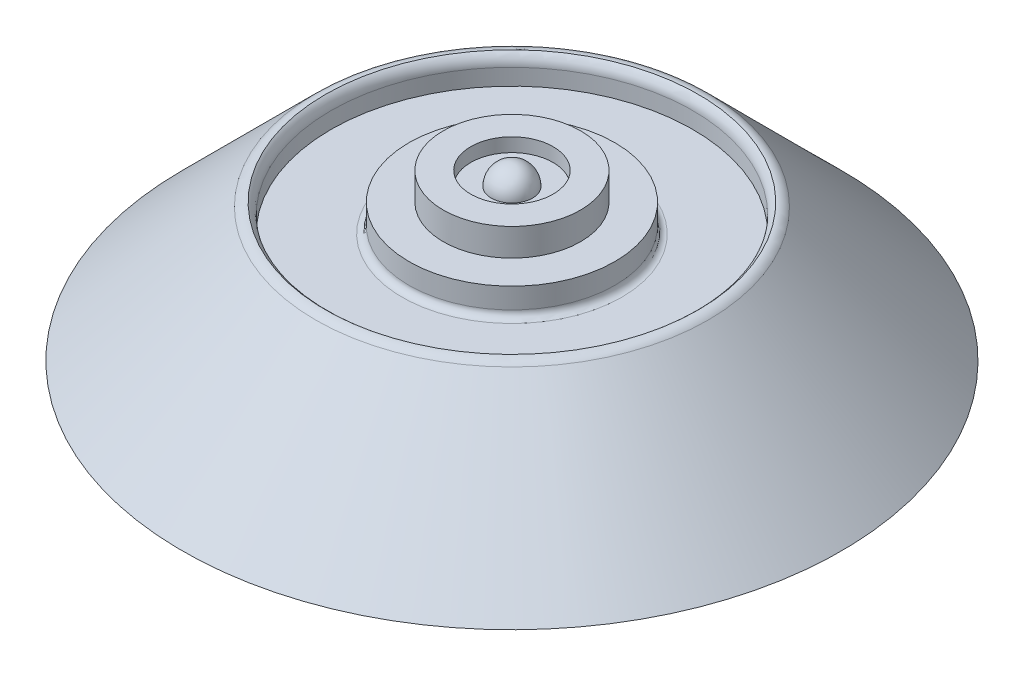
from build123d import *

# Parameters (mm, degrees)
FILLET1_R           = 2.54
SKETCH3_R           = 33.455795103
SKETCH3_R_2         = 19.05
CUT_EXTRUDE1_DEPTH  = 5.08
SKETCH4_R           = 12.7
BOSS_EXTRUDE1_DEPTH = 5.08
SKETCH5_R           = 7.62
CUT_EXTRUDE2_DEPTH  = 2.54
FILLET6_R           = 1.27
REVOLVE2_ANGLE      = 180
SCALE1_SCALE        = 0.5


with BuildPart() as part:
    # Sketch1 → Revolve1 (revolve)
    with BuildSketch(Plane.XY, mode=Mode.PRIVATE) as revolve1_sk:
        Polygon((0, 0), (0, -25.4), (60.96, -25.4), (35.56, 0), align=None)
    revolve(revolve1_sk.sketch.rotate(Axis((0, 0, 0), (0, -1, 0)), 180), axis=Axis((0, 0, 0), (0, -1, 0)))

    # Fillet1
    fillet1_edges = [part.edges().sort_by_distance(p)[0] for p in [
        (35.56, 0, 0),
    ]]
    fillet(fillet1_edges, radius=FILLET1_R)

    # Sketch3 → Cut-Extrude1 (cut)
    with BuildSketch(Plane(origin=(0, 0, 0), x_dir=(1, 0, 0), z_dir=(0, 1, 0))):
        with Locations(Location((0, 0, 0), (0, 0, 180))):
            Circle(SKETCH3_R)
        with Locations(Location((0, 0, 0), (0, 0, 180))):
            Circle(SKETCH3_R_2, mode=Mode.SUBTRACT)
    extrude(amount=-CUT_EXTRUDE1_DEPTH, mode=Mode.SUBTRACT)

    # Fillet4: read off the stored shape, not the designer's step
    # Fillet4 outline → Fillet4 (revolve, cut)
    with BuildSketch(Plane.XY):
        with BuildLine():
            ThreePointArc((33.455795103, -2.058582249), (33.73406349, -0.902654003), (34.507897552, 0))
            Line((34.507897552, 0), (33.455795103, 0))
            Line((33.455795103, 0), (33.455795103, -2.058582249))
        make_face()
    revolve(axis=Axis((0, 0, 0), (0, 1, 0)), mode=Mode.SUBTRACT)

    # Sketch4 → Boss-Extrude1 (add)
    with BuildSketch(Plane(origin=(0, 0, 0), x_dir=(1, 0, 0), z_dir=(0, 1, 0))):
        Circle(SKETCH4_R)
    extrude(amount=BOSS_EXTRUDE1_DEPTH)

    # Sketch5 → Cut-Extrude2 (cut)
    with BuildSketch(Plane(origin=(0, 5.08, 0), x_dir=(1, 0, 0), z_dir=(0, 1, 0))):
        with Locations(Location((0, 0, 0), (0, 0, 180))):
            Circle(SKETCH5_R)
    extrude(amount=-CUT_EXTRUDE2_DEPTH, mode=Mode.SUBTRACT)

    # Fillet6
    fillet6_edges = [part.edges().sort_by_distance(p)[0] for p in [
        (19.05, -5.08, 0),
    ]]
    fillet(fillet6_edges, radius=FILLET6_R)

    # Sketch6 → Revolve2 (revolve)
    with BuildSketch(Plane(origin=(0, 2.54, 0), x_dir=(1, 0, 0), z_dir=(0, 1, 0))):
        with BuildLine():
            Line((0, -3.81), (0, 3.81))
            ThreePointArc((0, 3.81), (-3.81, 0), (0, -3.81))
        make_face()
    revolve(axis=Axis((0, 2.54, 3.81), (0, 0, -1)), revolution_arc=REVOLVE2_ANGLE)


with BuildPart() as part_1:
    # Scale1: scaled about (0, -15.502710002, 0)
    add(part.part.scale(SCALE1_SCALE).moved(Location((0, -7.751355001, 0))))


solid = part_1.part
